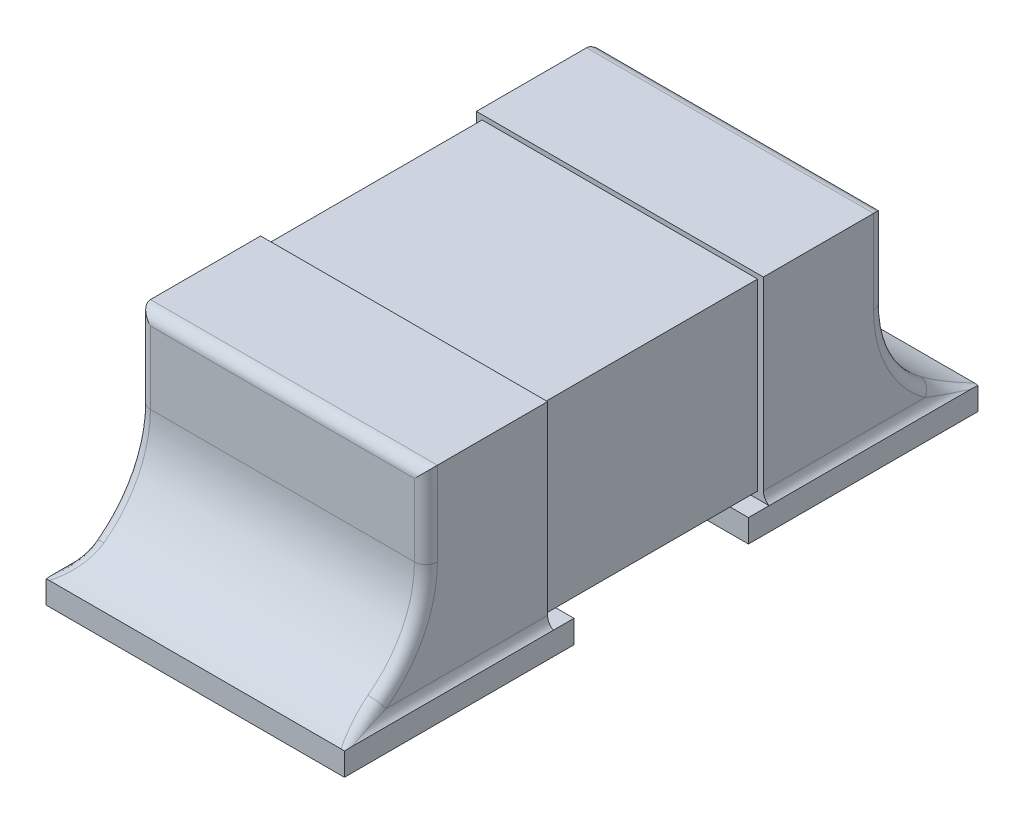
from build123d import *

# Parameters (mm, degrees)
SKETCH1_W                = 1.2
SKETCH1_H                = 0.8
BOSS_EXTRUDE1_DEPTH      = 0.97
BOSS_EXTRUDE2_DEPTH      = 0.03
BOSS_EXTRUDE2_DEPTH_BACK = 0.5
SKETCH2_W                = 1.25
SKETCH2_H                = 0.85
INDENT1_START            = -0.6
INDENT1_OUTLINE_W        = 0.8
INDENT1_OUTLINE_H        = 0.5
INDENT1_DEPTH            = 1.2
SKETCH3_W                = 1.3
SKETCH3_H                = 1
BOSS_EXTRUDE3_DEPTH      = 0.1
FILLET1_R                = 0.05
FILLET2_START            = -0.6500001
FILLET2_DEPTH            = 1.3000001
FILLET2_START_2          = 1
FILLET2_2_DEPTH          = 1
FILLET3_R                = 0.05


with BuildPart() as part:
    # Sketch1 → Boss-Extrude1 (new, symmetric)
    with BuildSketch(Plane.XY):
        with Locations((0, 0.53)):
            Rectangle(SKETCH1_W, SKETCH1_H)
    extrude(amount=BOSS_EXTRUDE1_DEPTH, both=True)


with BuildPart() as body_2:
    # Sketch2 → Boss-Extrude2 (new, two sides: drawn at the far end of the back side and taken through both)
    with BuildSketch(Plane.XY.offset(0.97).offset(-BOSS_EXTRUDE2_DEPTH_BACK)):
        with Locations((0, 0.525)):
            Rectangle(SKETCH2_W, SKETCH2_H)
    extrude(amount=BOSS_EXTRUDE2_DEPTH + BOSS_EXTRUDE2_DEPTH_BACK)

    # Indent1: read off the stored shape, not the designer's step
    # Indent1 outline → Indent1 (cut)
    with BuildSketch(Plane.YZ.offset(INDENT1_START)):
        with Locations((0.53, 0.72)):
            Rectangle(INDENT1_OUTLINE_W, INDENT1_OUTLINE_H)
    extrude(amount=INDENT1_DEPTH, mode=Mode.SUBTRACT)

    # Sketch3 → Boss-Extrude3 (add)
    with BuildSketch(Plane.XZ.offset(-0.1)):
        with Locations((0, 0.88)):
            Rectangle(SKETCH3_W, SKETCH3_H)
    extrude(amount=BOSS_EXTRUDE3_DEPTH)

    # Fillet1
    # the kernel refuses this fillet: 0.05 mm, written as the material it adds along each edge
    with BuildSketch(Plane(origin=(0.625, 0.1, 0.47), x_dir=(1, 0, 0), z_dir=(0, 0, 1)), Plane(origin=(-0.625, 0.1, 1), x_dir=(-1, 0, 0), z_dir=(0, 0, -1))) as fillet1_piece_1:
        with BuildLine():
            CenterArc((0.05, 0.04330127), FILLET1_R, 180, 60)
            Line((0, 0.04330127), (-0.001, 0.04330127))
            Line((-0.001, 0.04330127), (-0.001, 0))
            Line((-0.001, 0), (0, -0.001))
            ThreePointArc((0, -0.001), (0.0125, -0.001), (0.0245, -0.000866025))
            Line((0.0245, -0.000866025), (0.025, 0))
        make_face()
    extrude(amount=0.53)

    # Fillet2: read off the stored shape, not the designer's step
    # Fillet2 outline → Fillet2 (add)
    with BuildSketch(Plane.YZ.offset(FILLET2_START)):
        with BuildLine():
            ThreePointArc((0.585386444, 1), (0.277165744, 1.106299606), (0.1, 1.38))
            Line((0.1, 1.38), (0.1, 1))
            Line((0.1, 1), (0.585386444, 1))
        make_face()
    extrude(amount=FILLET2_DEPTH)

    # Fillet2 2 outline → Fillet2 2 (cut)
    with BuildSketch(Plane.XY.offset(FILLET2_START_2)):
        with BuildLine():
            Line((0.625, 2), (0.625, 0.14330127))
            ThreePointArc((0.625, 0.14330127), (0.63169873, 0.11830127), (0.65, 0.1))
            Line((0.65, 0.1), (0.65, 2))
            Line((0.65, 2), (0.625, 2))
        make_face()
        with BuildLine():
            Line((-0.625, 0.14330127), (-0.625, 2))
            Line((-0.625, 2), (-0.65, 2))
            Line((-0.65, 2), (-0.65, 0.1))
            ThreePointArc((-0.65, 0.1), (-0.63169873, 0.11830127), (-0.625, 0.14330127))
        make_face()
    extrude(amount=FILLET2_2_DEPTH, mode=Mode.SUBTRACT)

    # Fillet3
    fillet3_edges = [body_2.edges().sort_by_distance(p)[0] for p in [
        (-0.625, 0.767693222, 1),
        (0, 0.95, 1),
        (0.625, 0.767693222, 1),
        (0.625, 0.327308121, 1.071752899),
        (0.631998085, 0.117789797, 1.322931157),
        (-0.631998085, 0.117789797, 1.322931157),
        (-0.625, 0.327308121, 1.071752899),
    ]]
    fillet(fillet3_edges, radius=FILLET3_R)


with BuildPart() as body_3:
    # Mirror1: mirrored copy
    add(body_2.part.mirror(Plane.XY))


solid = Compound([part.part, body_2.part, body_3.part])
